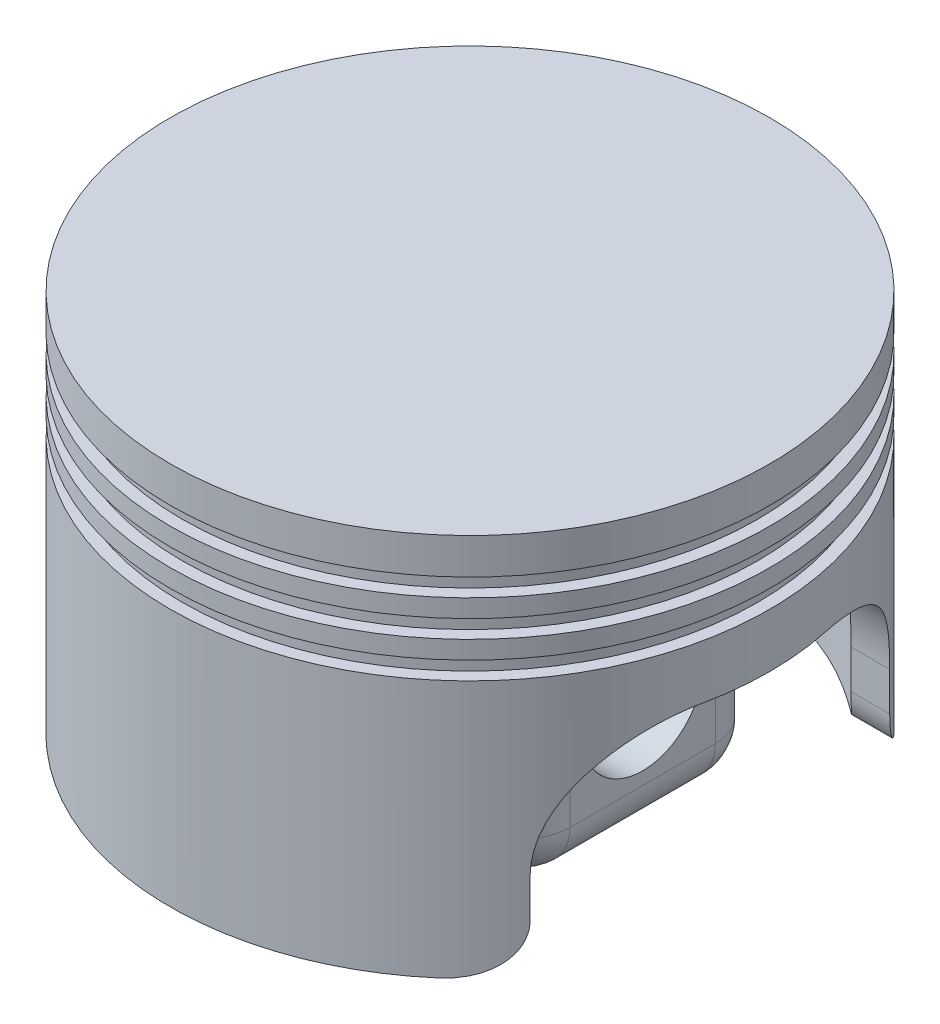
from build123d import *

# Parameters (mm, degrees)
SCHIZZO2_W                   = 2.54
SCHIZZO2_H                   = 3.81
RIPETIZIONE_A_L1_COUNT       = 3
RIPETIZIONE_A_L1_PITCH       = 7.62
SCHIZZO6_W                   = 76.2
SCHIZZO6_H                   = 43.18
TAGLIO_ESTRUSIONE1_DEPTH     = 126
RACCORDO1_R                  = 25
RACCORDO2_R                  = 10
SCHIZZO8_W                   = 19
SCHIZZO8_H                   = 50.8
ESTRUSIONE_ESTRUSIONE1_DEPTH = 63.5
RACCORDO3_R                  = 10
RACCORDO9_R                  = 10
RACCORDO10_R                 = 10
SCHIZZO11_R                  = 12.7
TAGLIO_ESTRUSIONE2_DEPTH     = 145.390105384
RACCORDO11_R                 = 5


with BuildPart() as part:
    # Schizzo1 → Rivoluzione3 (revolve)
    with BuildSketch(Plane.XY, mode=Mode.PRIVATE) as rivoluzione3_sk:
        Polygon((0, 0), (63.5, 0), (63.5, -81.28), (57.15, -81.28), (57.15, -19), (0, -19), align=None)
    revolve(rivoluzione3_sk.sketch.rotate(Axis((0, -19, 0), (0, 1, 0)), 90), axis=Axis((0, -19, 0), (0, 1, 0)))

    # Schizzo2 → Taglia-Rivoluzione1 (revolve, cut)
    with BuildSketch(Plane.XY, mode=Mode.PRIVATE) as taglia_rivoluzione1_sk:
        with Locations((62.23, -9.525)):
            Rectangle(SCHIZZO2_W, SCHIZZO2_H)
    taglia_rivoluzione1 = revolve(taglia_rivoluzione1_sk.sketch.rotate(Axis((0, -133.419588072, 0), (0, 1, 0)), 90), axis=Axis((0, -133.419588072, 0), (0, 1, 0)), mode=Mode.SUBTRACT)

    # Ripetizione a L1: Taglia-Rivoluzione1 ×3
    with Locations(*[(0, -i * RIPETIZIONE_A_L1_PITCH, 0) for i in range(1, RIPETIZIONE_A_L1_COUNT)]):
        add(taglia_rivoluzione1, mode=Mode.SUBTRACT)

    # Schizzo6 → Taglio-Estrusione1 (cut, symmetric)
    with BuildSketch(Plane(origin=(0, 0, 0), x_dir=(0, 0, -1), z_dir=(1, 0, 0))):
        with Locations((0, -59.69)):
            Rectangle(SCHIZZO6_W, SCHIZZO6_H)
    extrude(amount=TAGLIO_ESTRUSIONE1_DEPTH, both=True, mode=Mode.SUBTRACT)

    # Raccordo1
    # the kernel refuses this fillet: 25 mm, written as the material it adds along each edge
    with BuildSketch(Plane(origin=(113.3, -38.1, -38.1), x_dir=(0, 0, 1), z_dir=(-1, 0, 0))) as raccordo1_piece_1_section:
        with BuildLine():
            CenterArc((RACCORDO1_R, -RACCORDO1_R), RACCORDO1_R, 90, 90)
            Line((0, -RACCORDO1_R), (0, 0))
            Line((0, 0), (RACCORDO1_R, 0))
        make_face()
    raccordo1_piece_1 = extrude(amount=133.202905029, mode=Mode.PRIVATE)
    raccordo1_piece_1 = raccordo1_piece_1 & Plane(origin=(0, -38.1, 0), x_dir=(0, 0, -1), z_dir=(0, -1, 0)) * Cylinder(63.5, 367, mode=Mode.PRIVATE)
    raccordo1_piece_1 = raccordo1_piece_1 - Plane(origin=(0, -38.1, 0), x_dir=(0, 0, -1), z_dir=(0, 1, 0)) * Cylinder(57.15, 367, mode=Mode.PRIVATE)
    add(raccordo1_piece_1)
    with BuildSketch(Plane(origin=(-19.902905029, -38.1, 38.1), x_dir=(0, -1, 0), z_dir=(1, 0, 0))) as raccordo1_piece_2_section:
        with BuildLine():
            CenterArc((RACCORDO1_R, RACCORDO1_R), RACCORDO1_R, 180, 90)
            Line((0, RACCORDO1_R), (0, 0))
            Line((0, 0), (RACCORDO1_R, 0))
        make_face()
    raccordo1_piece_2 = extrude(amount=133.202905029, mode=Mode.PRIVATE)
    raccordo1_piece_2 = raccordo1_piece_2 & Plane(origin=(0, -38.1, 0), x_dir=(0, 0, -1), z_dir=(0, -1, 0)) * Cylinder(63.5, 367, mode=Mode.PRIVATE)
    raccordo1_piece_2 = raccordo1_piece_2 - Plane(origin=(0, -38.1, 0), x_dir=(0, 0, -1), z_dir=(0, 1, 0)) * Cylinder(57.15, 367, mode=Mode.PRIVATE)
    add(raccordo1_piece_2)
    with BuildSketch(Plane(origin=(19.902905029, -38.1, -38.1), x_dir=(0, -1, 0), z_dir=(-1, 0, 0))) as raccordo1_piece_3_section:
        with BuildLine():
            CenterArc((RACCORDO1_R, RACCORDO1_R), RACCORDO1_R, 180, 90)
            Line((0, RACCORDO1_R), (0, 0))
            Line((0, 0), (RACCORDO1_R, 0))
        make_face()
    raccordo1_piece_3 = extrude(amount=133.202905029, mode=Mode.PRIVATE)
    raccordo1_piece_3 = raccordo1_piece_3 & Plane(origin=(0, -38.1, 0), x_dir=(0, 0, -1), z_dir=(0, -1, 0)) * Cylinder(63.5, 367, mode=Mode.PRIVATE)
    raccordo1_piece_3 = raccordo1_piece_3 - Plane(origin=(0, -38.1, 0), x_dir=(0, 0, -1), z_dir=(0, 1, 0)) * Cylinder(57.15, 367, mode=Mode.PRIVATE)
    add(raccordo1_piece_3)
    with BuildSketch(Plane(origin=(-113.3, -38.1, 38.1), x_dir=(0, 0, -1), z_dir=(1, 0, 0))) as raccordo1_piece_4_section:
        with BuildLine():
            CenterArc((RACCORDO1_R, -RACCORDO1_R), RACCORDO1_R, 90, 90)
            Line((0, -RACCORDO1_R), (0, 0))
            Line((0, 0), (RACCORDO1_R, 0))
        make_face()
    raccordo1_piece_4 = extrude(amount=133.202905029, mode=Mode.PRIVATE)
    raccordo1_piece_4 = raccordo1_piece_4 & Plane(origin=(0, -38.1, 0), x_dir=(0, 0, -1), z_dir=(0, -1, 0)) * Cylinder(63.5, 367, mode=Mode.PRIVATE)
    raccordo1_piece_4 = raccordo1_piece_4 - Plane(origin=(0, -38.1, 0), x_dir=(0, 0, -1), z_dir=(0, 1, 0)) * Cylinder(57.15, 367, mode=Mode.PRIVATE)
    add(raccordo1_piece_4)

    # Raccordo2
    # the kernel refuses this fillet: 10 mm, written as the material it takes off along each edge
    with BuildSketch(Plane(origin=(75.8, -81.28, -38.1), x_dir=(0, 0, -1), z_dir=(-1, 0, 0)), Plane(origin=(17.597094971, -81.28, 38.1), x_dir=(0, 0, 1), z_dir=(1, 0, 0))) as raccordo2_piece_1:
        with BuildLine():
            CenterArc((RACCORDO2_R, -RACCORDO2_R), RACCORDO2_R, 90, 90)
            Line((0, -RACCORDO2_R), (0, 0))
            Line((0, 0), (RACCORDO2_R, 0))
        make_face()
    extrude(amount=58.202905029, mode=Mode.SUBTRACT)
    with BuildSketch(Plane(origin=(-75.8, -81.28, 38.1), x_dir=(0, 1, 0), z_dir=(1, 0, 0)), Plane(origin=(-17.597094971, -81.28, -38.1), x_dir=(0, 1, 0), z_dir=(-1, 0, 0))) as raccordo2_piece_2:
        with BuildLine():
            CenterArc((RACCORDO2_R, RACCORDO2_R), RACCORDO2_R, 180, 90)
            Line((0, RACCORDO2_R), (0, 0))
            Line((0, 0), (RACCORDO2_R, 0))
        make_face()
    extrude(amount=58.202905029, mode=Mode.SUBTRACT)

    # Schizzo8 → Estrusione-Estrusione1 (add)
    with BuildSketch(Plane.XZ.offset(19)):
        with Locations((-27.05, 0)):
            Rectangle(SCHIZZO8_W, SCHIZZO8_H)
    estrusione_estrusione1 = extrude(amount=ESTRUSIONE_ESTRUSIONE1_DEPTH)

    # Specchia1: Estrusione-Estrusione1 across plane
    add(estrusione_estrusione1.mirror(Plane(origin=(0, 0, 0), x_dir=(0, 0, 1), z_dir=(1, 0, 0))))

    # Raccordo3
    raccordo3_edges = [part.edges().sort_by_distance(p)[0] for p in [
        (-27.05, -82.5, 25.4),
        (-27.05, -82.5, -25.4),
        (27.05, -82.5, -25.4),
        (27.05, -82.5, 25.4),
    ]]
    fillet(raccordo3_edges, radius=RACCORDO3_R)

    # Raccordo9
    raccordo9_edges = [part.edges().sort_by_distance(p)[0] for p in [
        (-17.55, -82.5, 0),
        (-17.55, -45.75, 25.4),
        (-17.55, -45.75, -25.4),
        (-17.55, -79.571067812, 22.471067812),
        (-17.55, -79.571067812, -22.471067812),
        (36.55, -45.75, -25.4),
        (36.55, -82.5, 0),
        (36.55, -45.75, 25.4),
        (36.55, -79.571067812, 22.471067812),
        (36.55, -79.571067812, -22.471067812),
    ]]
    fillet(raccordo9_edges, radius=RACCORDO9_R)

    # Raccordo10
    # the kernel refuses this fillet: 10 mm, written as the material it takes off along each edge
    with BuildSketch(Plane(origin=(17.55, -19, -25.4), x_dir=(1, 0, 0), z_dir=(0, -1, 0))) as raccordo10_piece_1:
        with BuildLine():
            CenterArc((10, 9.949874371), RACCORDO10_R, 180, 84.260829523)
            Line((0, 9.949874371), (-0.2, 9.949874371))
            Line((-0.2, 9.949874371), (-0.2, 0))
            Line((-0.2, 0), (0, -0.2))
            ThreePointArc((0, -0.2), (4.5, -0.2), (8.98, -0.198997487))
            Line((8.98, -0.198997487), (9, 0))
        make_face()
    extrude(amount=53.5, mode=Mode.SUBTRACT)
    with BuildSketch(Plane(origin=(17.55, -72.5, -15.4), x_dir=(0, 0, -1), z_dir=(0, 1, 0))) as raccordo10_piece_2:
        with BuildLine():
            CenterArc((0.050125629, -10), RACCORDO10_R, 5.739170477, 84.260829523)
            Line((10, -9), (10.198997487, -8.98))
            ThreePointArc((10.198997487, -8.98), (10.2, -4.5), (10.2, 0))
            Line((10.2, 0), (10, 0.2))
            Line((10, 0.2), (0.050125629, 0.2))
            Line((0.050125629, 0.2), (0.050125629, 0))
        make_face()
    revolve(axis=Axis((17.55, -72.5, -15.4), (-1, 0, 0)), revolution_arc=90, mode=Mode.SUBTRACT)
    with BuildSketch(Plane(origin=(17.55, -19, 25.4), x_dir=(1, 0, 0), z_dir=(0, -1, 0)), Plane(origin=(-36.55, -19, 25.4), x_dir=(1, 0, 0), z_dir=(0, -1, 0))) as raccordo10_piece_3:
        with BuildLine():
            CenterArc((10, -9.949874371), RACCORDO10_R, 95.739170477, 84.260829523)
            Line((0, -9.949874371), (-0.2, -9.949874371))
            Line((-0.2, -9.949874371), (-0.2, 0))
            Line((-0.2, 0), (0, 0.2))
            ThreePointArc((0, 0.2), (4.5, 0.2), (8.98, 0.198997487))
            Line((8.98, 0.198997487), (9, 0))
        make_face()
    extrude(amount=53.5, mode=Mode.SUBTRACT)
    with BuildSketch(Plane(origin=(17.55, -72.5, 15.4), x_dir=(0, 0, 1), z_dir=(0, 1, 0))) as raccordo10_piece_4:
        with BuildLine():
            CenterArc((0.050125629, 10), RACCORDO10_R, 270, 84.260829523)
            Line((10, 9), (10.198997487, 8.98))
            ThreePointArc((10.198997487, 8.98), (10.2, 4.5), (10.2, 0))
            Line((10.2, 0), (10, -0.2))
            Line((10, -0.2), (0.050125629, -0.2))
            Line((0.050125629, -0.2), (0.050125629, 0))
        make_face()
    revolve(axis=Axis((17.55, -72.5, 15.4), (1, 0, 0)), revolution_arc=90, mode=Mode.SUBTRACT)
    with BuildSketch(Plane(origin=(17.55, -82.5, 15.4), x_dir=(0, 1, 0), z_dir=(0, 0, -1))) as raccordo10_piece_5:
        with BuildLine():
            CenterArc((9.949874371, 10), RACCORDO10_R, 185.739170477, 84.260829523)
            Line((0, 9), (-0.198997487, 8.98))
            ThreePointArc((-0.198997487, 8.98), (-0.2, 4.5), (-0.2, 0))
            Line((-0.2, 0), (0, -0.2))
            Line((0, -0.2), (9.949874371, -0.2))
            Line((9.949874371, -0.2), (9.949874371, 0))
        make_face()
    extrude(amount=30.8, mode=Mode.SUBTRACT)
    with BuildSketch(Plane(origin=(-36.55, -72.5, 15.4), x_dir=(0, 0, 1), z_dir=(0, 1, 0))) as raccordo10_piece_6:
        with BuildLine():
            CenterArc((0.050125629, 10), RACCORDO10_R, 270, 84.260829523)
            Line((10, 9), (10.198997487, 8.98))
            ThreePointArc((10.198997487, 8.98), (10.2, 4.5), (10.2, 0))
            Line((10.2, 0), (10, -0.2))
            Line((10, -0.2), (0.050125629, -0.2))
            Line((0.050125629, -0.2), (0.050125629, 0))
        make_face()
    revolve(axis=Axis((-36.55, -72.5, 15.4), (1, 0, 0)), revolution_arc=90, mode=Mode.SUBTRACT)
    with BuildSketch(Plane(origin=(-36.55, -19, -25.4), x_dir=(0, 0, 1), z_dir=(0, -1, 0))) as raccordo10_piece_7:
        with BuildLine():
            CenterArc((9.949874371, -10), RACCORDO10_R, 90, 84.260829523)
            Line((0, -9), (-0.198997487, -8.98))
            ThreePointArc((-0.198997487, -8.98), (-0.2, -4.5), (-0.2, 0))
            Line((-0.2, 0), (0, 0.2))
            Line((0, 0.2), (9.949874371, 0.2))
            Line((9.949874371, 0.2), (9.949874371, 0))
        make_face()
    extrude(amount=53.5, mode=Mode.SUBTRACT)
    with BuildSketch(Plane(origin=(-36.55, -72.5, -15.4), x_dir=(0, 0, -1), z_dir=(0, 1, 0))) as raccordo10_piece_8:
        with BuildLine():
            CenterArc((0.050125629, -10), RACCORDO10_R, 5.739170477, 84.260829523)
            Line((10, -9), (10.198997487, -8.98))
            ThreePointArc((10.198997487, -8.98), (10.2, -4.5), (10.2, 0))
            Line((10.2, 0), (10, 0.2))
            Line((10, 0.2), (0.050125629, 0.2))
            Line((0.050125629, 0.2), (0.050125629, 0))
        make_face()
    revolve(axis=Axis((-36.55, -72.5, -15.4), (-1, 0, 0)), revolution_arc=90, mode=Mode.SUBTRACT)
    with BuildSketch(Plane(origin=(-36.55, -82.5, -15.4), x_dir=(0, 1, 0), z_dir=(0, 0, 1))) as raccordo10_piece_9:
        with BuildLine():
            CenterArc((9.949874371, -10), RACCORDO10_R, 90, 84.260829523)
            Line((0, -9), (-0.198997487, -8.98))
            ThreePointArc((-0.198997487, -8.98), (-0.2, -4.5), (-0.2, 0))
            Line((-0.2, 0), (0, 0.2))
            Line((0, 0.2), (9.949874371, 0.2))
            Line((9.949874371, 0.2), (9.949874371, 0))
        make_face()
    extrude(amount=30.8, mode=Mode.SUBTRACT)

    # Schizzo11 → Taglio-Estrusione2 (cut, through all)
    with BuildSketch(Plane.ZY.offset(36.55)):
        with Locations((0, -57.1)):
            Circle(SCHIZZO11_R)
    extrude(amount=-TAGLIO_ESTRUSIONE2_DEPTH, mode=Mode.SUBTRACT)

    # Raccordo11
    raccordo11_edges = [part.edges().sort_by_distance(p)[0] for p in [
        (0, -19, 57.15),
    ]]
    fillet(raccordo11_edges, radius=RACCORDO11_R)


solid = part.part
